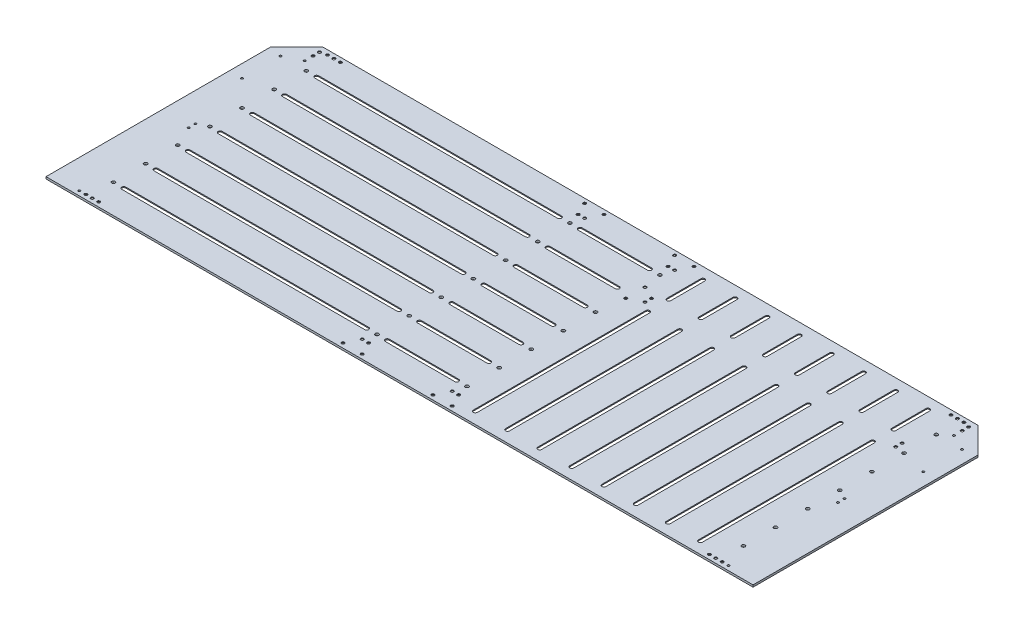
from build123d import *

# Parameters (mm, degrees)
SKETCH1_W                    = 1100
SKETCH1_H                    = 390
BOSS_EXTRUDE1_DEPTH          = 3.175
CHAMFER1_SIZE                = 40
STRUT_HOLES_D                = 3.3
FAN_HOLES_D                  = 3.3
FAN_SUPPORT_HOLES_AT_2_COUNT = 2
FAN_SUPPORT_HOLES_AT_2_PITCH = 10
FAN_SUPPORT_HOLES_AT_3_COUNT = 2
FAN_SUPPORT_HOLES_AT_3_PITCH = 10.307764064
FAN_SUPPORT_HOLES_AT_4_COUNT = 2
FAN_SUPPORT_HOLES_AT_4_PITCH = 30.103986447
FAN_SUPPORT_HOLES_AT_5_COUNT = 2
FAN_SUPPORT_HOLES_AT_5_PITCH = 20.155644371
FAN_SUPPORT_HOLES_AT_6_COUNT = 2
FAN_SUPPORT_HOLES_AT_6_PITCH = 374.035091937
FAN_SUPPORT_HOLES_AT_7_COUNT = 2
FAN_SUPPORT_HOLES_AT_7_PITCH = 374.702882295
FAN_SUPPORT_HOLES_AT_8_COUNT = 2
FAN_SUPPORT_HOLES_AT_8_PITCH = 373.633844827
T_SUPPORT_HOLES_D            = 4.5
T_SUPPORT_HOLES_DEPTH        = 15
T_SUPPORT_HOLES_CSINK_D      = 9.4
T_SUPPORT_HOLES_CSINK_ANGLE  = 90
T_SUPPORT_HOLES_TIP          = 1.351936393
ELEC_BAY_SLOTS_DEPTH         = 3.175
ELEC_BAY_SLOTS_2_DEPTH       = 1.675
BATTERY_BAY_SLOTS_DEPTH      = 3.175
BATTERY_BAY_SLOTS_2_DEPTH    = 1.675
BACK_BAY_SLOTS_DEPTH         = 3.175
BACK_BAY_SLOTS_2_DEPTH       = 1.675
LAPTOP_BAY_SLOTS_DEPTH       = 3.175
LAPTOP_BAY_SLOTS_2_DEPTH     = 1.675
MOUNTING_HOLES_D             = 5.3


# Read off the part's stored shape, not the designer's step: Elec Bay Slots, Battery Bay Slots, Back Bay Slots, Laptop Bay Slots
with BuildPart() as part:
    # Sketch1 → Boss-Extrude1 (new body)
    with BuildSketch(Plane(origin=(0, 0, 0), x_dir=(1, 0, 0), z_dir=(0, 1, 0))):
        Rectangle(SKETCH1_W, SKETCH1_H)
    extrude(amount=BOSS_EXTRUDE1_DEPTH)

    # Chamfer1
    chamfer1_edges = [part.edges().sort_by_distance(p)[0] for p in [
        (-550, 1.5875, -195),
        (550, 1.5875, -195),
    ]]
    chamfer(chamfer1_edges, length=CHAMFER1_SIZE)

    # Strut Holes (through all)
    with Locations(Plane(origin=(0, 3.175, 0), x_dir=(1, 0, 0), z_dir=(0, 1, 0))):
        with Locations((-530, 150), (-530, 90)):
            strut_holes = Hole(STRUT_HOLES_D / 2)

    # Fan Holes (through all)
    with Locations(Plane(origin=(0, 0, 0), x_dir=(-1, 0, 0), z_dir=(0, -1, 0))):
        with Locations((505, 162.5), (505, -7.5), (505, -18), (505, -188)):
            fan_holes = Hole(FAN_HOLES_D / 2)

    # Sketch15 → Fan Support Holes (revolve, cut)
    with BuildSketch(Plane(origin=(-505, 0, -185.5), x_dir=(0, 0, -1), z_dir=(1, 0, 0))):
        Polygon((0, 0), (0, 3.175), (2.25, 3.175), (2.25, 2.23), (4.48, 0), align=None)
    fan_support_holes = revolve(axis=Axis((-505, -6.35, -185.5), (0, 1, 0)), mode=Mode.SUBTRACT)

    # Fan Support Holes at 2: Fan Support Holes ×2
    with Locations(*[(0, 0, i * FAN_SUPPORT_HOLES_AT_2_PITCH) for i in range(1, FAN_SUPPORT_HOLES_AT_2_COUNT)]):
        add(fan_support_holes, mode=Mode.SUBTRACT)

    # Fan Support Holes at 3: Fan Support Holes ×2
    with Locations(*[Vector(0.9701425001453327, 0, -0.2425356250363304) * (i * FAN_SUPPORT_HOLES_AT_3_PITCH) for i in range(1, FAN_SUPPORT_HOLES_AT_3_COUNT)]):
        add(fan_support_holes, mode=Mode.SUBTRACT)

    # Fan Support Holes at 4: Fan Support Holes ×2
    with Locations(*[Vector(0.9965457582448797, 0, -0.08304547985373965) * (i * FAN_SUPPORT_HOLES_AT_4_PITCH) for i in range(1, FAN_SUPPORT_HOLES_AT_4_COUNT)]):
        add(fan_support_holes, mode=Mode.SUBTRACT)

    # Fan Support Holes at 5: Fan Support Holes ×2
    with Locations(*[Vector(0.9922778767136677, 0, -0.12403473458920776) * (i * FAN_SUPPORT_HOLES_AT_5_PITCH) for i in range(1, FAN_SUPPORT_HOLES_AT_5_COUNT)]):
        add(fan_support_holes, mode=Mode.SUBTRACT)

    # Fan Support Holes at 6: Fan Support Holes ×2
    with Locations(*[Vector(0.053470918721689506, 0, 0.9985694071275459) * (i * FAN_SUPPORT_HOLES_AT_6_PITCH) for i in range(1, FAN_SUPPORT_HOLES_AT_6_COUNT)]):
        add(fan_support_holes, mode=Mode.SUBTRACT)

    # Fan Support Holes at 7: Fan Support Holes ×2
    with Locations(*[Vector(0.08006343537117683, 0, 0.9967897703711478) * (i * FAN_SUPPORT_HOLES_AT_7_PITCH) for i in range(1, FAN_SUPPORT_HOLES_AT_7_COUNT)]):
        add(fan_support_holes, mode=Mode.SUBTRACT)

    # Fan Support Holes at 8: Fan Support Holes ×2
    with Locations(*[Vector(0.026764170694005832, 0, 0.9996417754211067) * (i * FAN_SUPPORT_HOLES_AT_8_PITCH) for i in range(1, FAN_SUPPORT_HOLES_AT_8_COUNT)]):
        add(fan_support_holes, mode=Mode.SUBTRACT)

    # Mirror1: Strut Holes, Fan Holes, Fan Support Holes across plane
    add(strut_holes.mirror(Plane(origin=(0, 0, 0), x_dir=(0, 0, 1), z_dir=(1, 0, 0))), mode=Mode.SUBTRACT)
    add(fan_holes.mirror(Plane(origin=(0, 0, 0), x_dir=(0, 0, 1), z_dir=(1, 0, 0))), mode=Mode.SUBTRACT)
    add(fan_support_holes.mirror(Plane(origin=(0, 0, 0), x_dir=(0, 0, 1), z_dir=(1, 0, 0))), mode=Mode.SUBTRACT)

    # Mirror1 copy 1 sketch → Mirror1 copy 1 (revolve, cut)
    with BuildSketch(Plane(origin=(505, 0, -175.5), x_dir=(0, 0, -1), z_dir=(-1, 0, 0))):
        Polygon((0, 0), (0, -3.175), (2.25, -3.175), (2.25, -2.23), (4.48, 0), align=None)
    revolve(axis=Axis((505, -6.35, -175.5), (0, -1, 0)), mode=Mode.SUBTRACT)

    # Mirror1 copy 2 sketch → Mirror1 copy 2 (revolve, cut)
    with BuildSketch(Plane(origin=(495, 0, -188), x_dir=(0, 0, -1), z_dir=(-1, 0, 0))):
        Polygon((0, 0), (0, -3.175), (2.25, -3.175), (2.25, -2.23), (4.48, 0), align=None)
    revolve(axis=Axis((495, -6.35, -188), (0, -1, 0)), mode=Mode.SUBTRACT)

    # Mirror1 copy 3 sketch → Mirror1 copy 3 (revolve, cut)
    with BuildSketch(Plane(origin=(475, 0, -188), x_dir=(0, 0, -1), z_dir=(-1, 0, 0))):
        Polygon((0, 0), (0, -3.175), (2.25, -3.175), (2.25, -2.23), (4.48, 0), align=None)
    revolve(axis=Axis((475, -6.35, -188), (0, -1, 0)), mode=Mode.SUBTRACT)

    # Mirror1 copy 4 sketch → Mirror1 copy 4 (revolve, cut)
    with BuildSketch(Plane(origin=(485, 0, -188), x_dir=(0, 0, -1), z_dir=(-1, 0, 0))):
        Polygon((0, 0), (0, -3.175), (2.25, -3.175), (2.25, -2.23), (4.48, 0), align=None)
    revolve(axis=Axis((485, -6.35, -188), (0, -1, 0)), mode=Mode.SUBTRACT)

    # Mirror1 copy 5 sketch → Mirror1 copy 5 (revolve, cut)
    with BuildSketch(Plane(origin=(485, 0, 188), x_dir=(0, 0, -1), z_dir=(-1, 0, 0))):
        Polygon((0, 0), (0, -3.175), (2.25, -3.175), (2.25, -2.23), (4.48, 0), align=None)
    revolve(axis=Axis((485, -6.35, 188), (0, -1, 0)), mode=Mode.SUBTRACT)

    # Mirror1 copy 6 sketch → Mirror1 copy 6 (revolve, cut)
    with BuildSketch(Plane(origin=(475, 0, 188), x_dir=(0, 0, -1), z_dir=(-1, 0, 0))):
        Polygon((0, 0), (0, -3.175), (2.25, -3.175), (2.25, -2.23), (4.48, 0), align=None)
    revolve(axis=Axis((475, -6.35, 188), (0, -1, 0)), mode=Mode.SUBTRACT)

    # Mirror1 copy 7 sketch → Mirror1 copy 7 (revolve, cut)
    with BuildSketch(Plane(origin=(495, 0, 188), x_dir=(0, 0, -1), z_dir=(-1, 0, 0))):
        Polygon((0, 0), (0, -3.175), (2.25, -3.175), (2.25, -2.23), (4.48, 0), align=None)
    revolve(axis=Axis((495, -6.35, 188), (0, -1, 0)), mode=Mode.SUBTRACT)

    # T Support Holes
    with Locations(Plane(origin=(0, 0, 0), x_dir=(-1, 0, 0), z_dir=(0, -1, 0))):
        with Locations((-75, -188), (-45, -188), (-65, -168), (-55, -168), (-55, 168), (-65, 168), (-45, 188), (-75, 188), (65, -188), (95, -188), (75, -168), (85, -168), (85, 168), (75, 168), (95, 188), (65, 188), (-65, 122), (-65, 92), (-85, 112), (-85, 102), (-475, 112), (-475, 102)):
            CounterSinkHole(T_SUPPORT_HOLES_D / 2, T_SUPPORT_HOLES_CSINK_D / 2, depth=T_SUPPORT_HOLES_DEPTH, counter_sink_angle=T_SUPPORT_HOLES_CSINK_ANGLE)
            with Locations((0, 0, -(T_SUPPORT_HOLES_DEPTH + T_SUPPORT_HOLES_TIP / 2))):  # 118° drill point
                Cone(0, T_SUPPORT_HOLES_D / 2, T_SUPPORT_HOLES_TIP, mode=Mode.SUBTRACT)

    # Elec Bay Slots outline → Elec Bay Slots (cut)
    with BuildSketch(Plane(origin=(0, 0, 0), x_dir=(1, 0, 0), z_dir=(0, 1, 0))):
        with BuildLine():
            ThreePointArc((-96, -153.1), (-92.9, -150), (-96, -146.9))
            Line((-96, -146.9), (-474, -146.9))
            ThreePointArc((-474, -146.9), (-477.1, -150), (-474, -153.1))
            Line((-474, -153.1), (-96, -153.1))
        make_face()
        with BuildLine():
            ThreePointArc((-96, -103.1), (-92.9, -100), (-96, -96.9))
            Line((-96, -96.9), (-474, -96.9))
            ThreePointArc((-474, -96.9), (-477.1, -100), (-474, -103.1))
            Line((-474, -103.1), (-96, -103.1))
        make_face()
        with BuildLine():
            ThreePointArc((-96, -53.1), (-92.9, -50), (-96, -46.9))
            Line((-96, -46.9), (-474, -46.9))
            ThreePointArc((-474, -46.9), (-477.1, -50), (-474, -53.1))
            Line((-474, -53.1), (-96, -53.1))
        make_face()
        with BuildLine():
            ThreePointArc((-96, -3.1), (-92.9, 0), (-96, 3.1))
            Line((-96, 3.1), (-474, 3.1))
            ThreePointArc((-474, 3.1), (-477.1, 0), (-474, -3.1))
            Line((-474, -3.1), (-96, -3.1))
        make_face()
        with BuildLine():
            ThreePointArc((-96, 46.9), (-92.9, 50), (-96, 53.1))
            Line((-96, 53.1), (-474, 53.1))
            ThreePointArc((-474, 53.1), (-477.1, 50), (-474, 46.9))
            Line((-474, 46.9), (-96, 46.9))
        make_face()
        with BuildLine():
            ThreePointArc((-96, 96.9), (-92.9, 100), (-96, 103.1))
            Line((-96, 103.1), (-474, 103.1))
            ThreePointArc((-474, 103.1), (-477.1, 100), (-474, 96.9))
            Line((-474, 96.9), (-96, 96.9))
        make_face()
        with BuildLine():
            ThreePointArc((-96, 146.9), (-92.9, 150), (-96, 153.1))
            Line((-96, 153.1), (-474, 153.1))
            ThreePointArc((-474, 153.1), (-477.1, 150), (-474, 146.9))
            Line((-474, 146.9), (-96, 146.9))
        make_face()
    extrude(amount=ELEC_BAY_SLOTS_DEPTH, mode=Mode.SUBTRACT)

    # Elec Bay Slots 2 outline → Elec Bay Slots 2 (cut)
    # profile 1 of 7: a face of its own
    with BuildSketch(Plane(origin=(0, 0, 0), x_dir=(1, 0, 0), z_dir=(0, 1, 0))):
        with BuildLine():
            ThreePointArc((-96, -155.5), (-90.5, -150), (-96, -144.5))
            Line((-96, -144.5), (-474, -144.5))
            ThreePointArc((-474, -144.5), (-479.5, -150), (-474, -155.5))
            Line((-474, -155.5), (-96, -155.5))
        make_face()
        with BuildLine():
            Line((-474, -146.9), (-96, -146.9))
            ThreePointArc((-96, -146.9), (-92.9, -150), (-96, -153.1))
            Line((-96, -153.1), (-474, -153.1))
            ThreePointArc((-474, -153.1), (-477.1, -150), (-474, -146.9))
        make_face(mode=Mode.SUBTRACT)
    # profile 2 of 7: a face of its own
    with BuildSketch(Plane(origin=(0, 0, 0), x_dir=(1, 0, 0), z_dir=(0, 1, 0))):
        with BuildLine():
            ThreePointArc((-96, -105.5), (-90.5, -100), (-96, -94.5))
            Line((-96, -94.5), (-474, -94.5))
            ThreePointArc((-474, -94.5), (-479.5, -100), (-474, -105.5))
            Line((-474, -105.5), (-96, -105.5))
        make_face()
        with BuildLine():
            Line((-474, -96.9), (-96, -96.9))
            ThreePointArc((-96, -96.9), (-92.9, -100), (-96, -103.1))
            Line((-96, -103.1), (-474, -103.1))
            ThreePointArc((-474, -103.1), (-477.1, -100), (-474, -96.9))
        make_face(mode=Mode.SUBTRACT)
    # profile 3 of 7: a face of its own
    with BuildSketch(Plane(origin=(0, 0, 0), x_dir=(1, 0, 0), z_dir=(0, 1, 0))):
        with BuildLine():
            ThreePointArc((-96, -55.5), (-90.5, -50), (-96, -44.5))
            Line((-96, -44.5), (-474, -44.5))
            ThreePointArc((-474, -44.5), (-479.5, -50), (-474, -55.5))
            Line((-474, -55.5), (-96, -55.5))
        make_face()
        with BuildLine():
            Line((-474, -46.9), (-96, -46.9))
            ThreePointArc((-96, -46.9), (-92.9, -50), (-96, -53.1))
            Line((-96, -53.1), (-474, -53.1))
            ThreePointArc((-474, -53.1), (-477.1, -50), (-474, -46.9))
        make_face(mode=Mode.SUBTRACT)
    # profile 4 of 7: a face of its own
    with BuildSketch(Plane(origin=(0, 0, 0), x_dir=(1, 0, 0), z_dir=(0, 1, 0))):
        with BuildLine():
            ThreePointArc((-96, -5.5), (-90.5, 0), (-96, 5.5))
            Line((-96, 5.5), (-474, 5.5))
            ThreePointArc((-474, 5.5), (-479.5, 0), (-474, -5.5))
            Line((-474, -5.5), (-96, -5.5))
        make_face()
        with BuildLine():
            Line((-474, 3.1), (-96, 3.1))
            ThreePointArc((-96, 3.1), (-92.9, 0), (-96, -3.1))
            Line((-96, -3.1), (-474, -3.1))
            ThreePointArc((-474, -3.1), (-477.1, 0), (-474, 3.1))
        make_face(mode=Mode.SUBTRACT)
    # profile 5 of 7: a face of its own
    with BuildSketch(Plane(origin=(0, 0, 0), x_dir=(1, 0, 0), z_dir=(0, 1, 0))):
        with BuildLine():
            ThreePointArc((-96, 44.5), (-90.5, 50), (-96, 55.5))
            Line((-96, 55.5), (-474, 55.5))
            ThreePointArc((-474, 55.5), (-479.5, 50), (-474, 44.5))
            Line((-474, 44.5), (-96, 44.5))
        make_face()
        with BuildLine():
            Line((-474, 53.1), (-96, 53.1))
            ThreePointArc((-96, 53.1), (-92.9, 50), (-96, 46.9))
            Line((-96, 46.9), (-474, 46.9))
            ThreePointArc((-474, 46.9), (-477.1, 50), (-474, 53.1))
        make_face(mode=Mode.SUBTRACT)
    # profile 6 of 7: a face of its own
    with BuildSketch(Plane(origin=(0, 0, 0), x_dir=(1, 0, 0), z_dir=(0, 1, 0))):
        with BuildLine():
            ThreePointArc((-96, 94.5), (-90.5, 100), (-96, 105.5))
            Line((-96, 105.5), (-474, 105.5))
            ThreePointArc((-474, 105.5), (-479.5, 100), (-474, 94.5))
            Line((-474, 94.5), (-96, 94.5))
        make_face()
        with BuildLine():
            Line((-474, 103.1), (-96, 103.1))
            ThreePointArc((-96, 103.1), (-92.9, 100), (-96, 96.9))
            Line((-96, 96.9), (-474, 96.9))
            ThreePointArc((-474, 96.9), (-477.1, 100), (-474, 103.1))
        make_face(mode=Mode.SUBTRACT)
    # profile 7 of 7: a face of its own
    with BuildSketch(Plane(origin=(0, 0, 0), x_dir=(1, 0, 0), z_dir=(0, 1, 0))):
        with BuildLine():
            ThreePointArc((-96, 144.5), (-90.5, 150), (-96, 155.5))
            Line((-96, 155.5), (-474, 155.5))
            ThreePointArc((-474, 155.5), (-479.5, 150), (-474, 144.5))
            Line((-474, 144.5), (-96, 144.5))
        make_face()
        with BuildLine():
            Line((-474, 153.1), (-96, 153.1))
            ThreePointArc((-96, 153.1), (-92.9, 150), (-96, 146.9))
            Line((-96, 146.9), (-474, 146.9))
            ThreePointArc((-474, 146.9), (-477.1, 150), (-474, 153.1))
        make_face(mode=Mode.SUBTRACT)
    extrude(amount=ELEC_BAY_SLOTS_2_DEPTH, mode=Mode.SUBTRACT)

    # Battery Bay Slots outline → Battery Bay Slots (cut)
    with BuildSketch(Plane(origin=(0, 0, 0), x_dir=(1, 0, 0), z_dir=(0, 1, 0))):
        with BuildLine():
            ThreePointArc((-64, -146.9), (-67.1, -150), (-64, -153.1))
            Line((-64, -153.1), (44, -153.1))
            ThreePointArc((44, -153.1), (47.1, -150), (44, -146.9))
            Line((44, -146.9), (-64, -146.9))
        make_face()
        with BuildLine():
            ThreePointArc((-64, -96.9), (-67.1, -100), (-64, -103.1))
            Line((-64, -103.1), (44, -103.1))
            ThreePointArc((44, -103.1), (47.1, -100), (44, -96.9))
            Line((44, -96.9), (-64, -96.9))
        make_face()
        with BuildLine():
            ThreePointArc((-64, -46.9), (-67.1, -50), (-64, -53.1))
            Line((-64, -53.1), (44, -53.1))
            ThreePointArc((44, -53.1), (47.1, -50), (44, -46.9))
            Line((44, -46.9), (-64, -46.9))
        make_face()
        with BuildLine():
            ThreePointArc((-64, 3.1), (-67.1, 0), (-64, -3.1))
            Line((-64, -3.1), (44, -3.1))
            ThreePointArc((44, -3.1), (47.1, 0), (44, 3.1))
            Line((44, 3.1), (-64, 3.1))
        make_face()
        with BuildLine():
            ThreePointArc((-64, 53.1), (-67.1, 50), (-64, 46.9))
            Line((-64, 46.9), (44, 46.9))
            ThreePointArc((44, 46.9), (47.1, 50), (44, 53.1))
            Line((44, 53.1), (-64, 53.1))
        make_face()
        with BuildLine():
            ThreePointArc((-64, 103.1), (-67.1, 100), (-64, 96.9))
            Line((-64, 96.9), (44, 96.9))
            ThreePointArc((44, 96.9), (47.1, 100), (44, 103.1))
            Line((44, 103.1), (-64, 103.1))
        make_face()
        with BuildLine():
            ThreePointArc((-64, 153.1), (-67.1, 150), (-64, 146.9))
            Line((-64, 146.9), (44, 146.9))
            ThreePointArc((44, 146.9), (47.1, 150), (44, 153.1))
            Line((44, 153.1), (-64, 153.1))
        make_face()
    extrude(amount=BATTERY_BAY_SLOTS_DEPTH, mode=Mode.SUBTRACT)

    # Battery Bay Slots 2 outline → Battery Bay Slots 2 (cut)
    # profile 1 of 7: a face of its own
    with BuildSketch(Plane(origin=(0, 0, 0), x_dir=(1, 0, 0), z_dir=(0, 1, 0))):
        with BuildLine():
            ThreePointArc((-64, -144.5), (-69.5, -150), (-64, -155.5))
            Line((-64, -155.5), (44, -155.5))
            ThreePointArc((44, -155.5), (49.5, -150), (44, -144.5))
            Line((44, -144.5), (-64, -144.5))
        make_face()
        with BuildLine():
            Line((44, -153.1), (-64, -153.1))
            ThreePointArc((-64, -153.1), (-67.1, -150), (-64, -146.9))
            Line((-64, -146.9), (44, -146.9))
            ThreePointArc((44, -146.9), (47.1, -150), (44, -153.1))
        make_face(mode=Mode.SUBTRACT)
    # profile 2 of 7: a face of its own
    with BuildSketch(Plane(origin=(0, 0, 0), x_dir=(1, 0, 0), z_dir=(0, 1, 0))):
        with BuildLine():
            ThreePointArc((-64, -94.5), (-69.5, -100), (-64, -105.5))
            Line((-64, -105.5), (44, -105.5))
            ThreePointArc((44, -105.5), (49.5, -100), (44, -94.5))
            Line((44, -94.5), (-64, -94.5))
        make_face()
        with BuildLine():
            Line((44, -103.1), (-64, -103.1))
            ThreePointArc((-64, -103.1), (-67.1, -100), (-64, -96.9))
            Line((-64, -96.9), (44, -96.9))
            ThreePointArc((44, -96.9), (47.1, -100), (44, -103.1))
        make_face(mode=Mode.SUBTRACT)
    # profile 3 of 7: a face of its own
    with BuildSketch(Plane(origin=(0, 0, 0), x_dir=(1, 0, 0), z_dir=(0, 1, 0))):
        with BuildLine():
            ThreePointArc((-64, -44.5), (-69.5, -50), (-64, -55.5))
            Line((-64, -55.5), (44, -55.5))
            ThreePointArc((44, -55.5), (49.5, -50), (44, -44.5))
            Line((44, -44.5), (-64, -44.5))
        make_face()
        with BuildLine():
            Line((44, -53.1), (-64, -53.1))
            ThreePointArc((-64, -53.1), (-67.1, -50), (-64, -46.9))
            Line((-64, -46.9), (44, -46.9))
            ThreePointArc((44, -46.9), (47.1, -50), (44, -53.1))
        make_face(mode=Mode.SUBTRACT)
    # profile 4 of 7: a face of its own
    with BuildSketch(Plane(origin=(0, 0, 0), x_dir=(1, 0, 0), z_dir=(0, 1, 0))):
        with BuildLine():
            ThreePointArc((-64, 5.5), (-69.5, 0), (-64, -5.5))
            Line((-64, -5.5), (44, -5.5))
            ThreePointArc((44, -5.5), (49.5, 0), (44, 5.5))
            Line((44, 5.5), (-64, 5.5))
        make_face()
        with BuildLine():
            Line((44, -3.1), (-64, -3.1))
            ThreePointArc((-64, -3.1), (-67.1, 0), (-64, 3.1))
            Line((-64, 3.1), (44, 3.1))
            ThreePointArc((44, 3.1), (47.1, 0), (44, -3.1))
        make_face(mode=Mode.SUBTRACT)
    # profile 5 of 7: a face of its own
    with BuildSketch(Plane(origin=(0, 0, 0), x_dir=(1, 0, 0), z_dir=(0, 1, 0))):
        with BuildLine():
            ThreePointArc((-64, 55.5), (-69.5, 50), (-64, 44.5))
            Line((-64, 44.5), (44, 44.5))
            ThreePointArc((44, 44.5), (49.5, 50), (44, 55.5))
            Line((44, 55.5), (-64, 55.5))
        make_face()
        with BuildLine():
            Line((44, 46.9), (-64, 46.9))
            ThreePointArc((-64, 46.9), (-67.1, 50), (-64, 53.1))
            Line((-64, 53.1), (44, 53.1))
            ThreePointArc((44, 53.1), (47.1, 50), (44, 46.9))
        make_face(mode=Mode.SUBTRACT)
    # profile 6 of 7: a face of its own
    with BuildSketch(Plane(origin=(0, 0, 0), x_dir=(1, 0, 0), z_dir=(0, 1, 0))):
        with BuildLine():
            ThreePointArc((-64, 105.5), (-69.5, 100), (-64, 94.5))
            Line((-64, 94.5), (44, 94.5))
            ThreePointArc((44, 94.5), (49.5, 100), (44, 105.5))
            Line((44, 105.5), (-64, 105.5))
        make_face()
        with BuildLine():
            Line((44, 96.9), (-64, 96.9))
            ThreePointArc((-64, 96.9), (-67.1, 100), (-64, 103.1))
            Line((-64, 103.1), (44, 103.1))
            ThreePointArc((44, 103.1), (47.1, 100), (44, 96.9))
        make_face(mode=Mode.SUBTRACT)
    # profile 7 of 7: a face of its own
    with BuildSketch(Plane(origin=(0, 0, 0), x_dir=(1, 0, 0), z_dir=(0, 1, 0))):
        with BuildLine():
            ThreePointArc((-64, 155.5), (-69.5, 150), (-64, 144.5))
            Line((-64, 144.5), (44, 144.5))
            ThreePointArc((44, 144.5), (49.5, 150), (44, 155.5))
            Line((44, 155.5), (-64, 155.5))
        make_face()
        with BuildLine():
            Line((44, 146.9), (-64, 146.9))
            ThreePointArc((-64, 146.9), (-67.1, 150), (-64, 153.1))
            Line((-64, 153.1), (44, 153.1))
            ThreePointArc((44, 153.1), (47.1, 150), (44, 146.9))
        make_face(mode=Mode.SUBTRACT)
    extrude(amount=BATTERY_BAY_SLOTS_2_DEPTH, mode=Mode.SUBTRACT)

    # Back Bay Slots outline → Back Bay Slots (cut)
    with BuildSketch(Plane(origin=(0, 0, 0), x_dir=(1, 0, 0), z_dir=(0, 1, 0))):
        with BuildLine():
            ThreePointArc((103.1, 177), (100, 180.1), (96.9, 177))
            Line((96.9, 177), (96.9, 124))
            ThreePointArc((96.9, 124), (100, 120.9), (103.1, 124))
            Line((103.1, 124), (103.1, 177))
        make_face()
        with BuildLine():
            ThreePointArc((153.1, 177), (150, 180.1), (146.9, 177))
            Line((146.9, 177), (146.9, 124))
            ThreePointArc((146.9, 124), (150, 120.9), (153.1, 124))
            Line((153.1, 124), (153.1, 177))
        make_face()
        with BuildLine():
            ThreePointArc((203.1, 177), (200, 180.1), (196.9, 177))
            Line((196.9, 177), (196.9, 124))
            ThreePointArc((196.9, 124), (200, 120.9), (203.1, 124))
            Line((203.1, 124), (203.1, 177))
        make_face()
        with BuildLine():
            ThreePointArc((253.1, 177), (250, 180.1), (246.9, 177))
            Line((246.9, 177), (246.9, 124))
            ThreePointArc((246.9, 124), (250, 120.9), (253.1, 124))
            Line((253.1, 124), (253.1, 177))
        make_face()
        with BuildLine():
            ThreePointArc((303.1, 177), (300, 180.1), (296.9, 177))
            Line((296.9, 177), (296.9, 124))
            ThreePointArc((296.9, 124), (300, 120.9), (303.1, 124))
            Line((303.1, 124), (303.1, 177))
        make_face()
        with BuildLine():
            ThreePointArc((353.1, 177), (350, 180.1), (346.9, 177))
            Line((346.9, 177), (346.9, 124))
            ThreePointArc((346.9, 124), (350, 120.9), (353.1, 124))
            Line((353.1, 124), (353.1, 177))
        make_face()
        with BuildLine():
            ThreePointArc((403.1, 177), (400, 180.1), (396.9, 177))
            Line((396.9, 177), (396.9, 124))
            ThreePointArc((396.9, 124), (400, 120.9), (403.1, 124))
            Line((403.1, 124), (403.1, 177))
        make_face()
        with BuildLine():
            ThreePointArc((453.1, 177), (450, 180.1), (446.9, 177))
            Line((446.9, 177), (446.9, 124))
            ThreePointArc((446.9, 124), (450, 120.9), (453.1, 124))
            Line((453.1, 124), (453.1, 177))
        make_face()
    extrude(amount=BACK_BAY_SLOTS_DEPTH, mode=Mode.SUBTRACT)

    # Back Bay Slots 2 outline → Back Bay Slots 2 (cut)
    # profile 1 of 8: a face of its own
    with BuildSketch(Plane(origin=(0, 0, 0), x_dir=(1, 0, 0), z_dir=(0, 1, 0))):
        with BuildLine():
            ThreePointArc((105.5, 177), (100, 182.5), (94.5, 177))
            Line((94.5, 177), (94.5, 124))
            ThreePointArc((94.5, 124), (100, 118.5), (105.5, 124))
            Line((105.5, 124), (105.5, 177))
        make_face()
        with BuildLine():
            Line((96.9, 124), (96.9, 177))
            ThreePointArc((96.9, 177), (100, 180.1), (103.1, 177))
            Line((103.1, 177), (103.1, 124))
            ThreePointArc((103.1, 124), (100, 120.9), (96.9, 124))
        make_face(mode=Mode.SUBTRACT)
    # profile 2 of 8: a face of its own
    with BuildSketch(Plane(origin=(0, 0, 0), x_dir=(1, 0, 0), z_dir=(0, 1, 0))):
        with BuildLine():
            ThreePointArc((155.5, 177), (150, 182.5), (144.5, 177))
            Line((144.5, 177), (144.5, 124))
            ThreePointArc((144.5, 124), (150, 118.5), (155.5, 124))
            Line((155.5, 124), (155.5, 177))
        make_face()
        with BuildLine():
            Line((146.9, 124), (146.9, 177))
            ThreePointArc((146.9, 177), (150, 180.1), (153.1, 177))
            Line((153.1, 177), (153.1, 124))
            ThreePointArc((153.1, 124), (150, 120.9), (146.9, 124))
        make_face(mode=Mode.SUBTRACT)
    # profile 3 of 8: a face of its own
    with BuildSketch(Plane(origin=(0, 0, 0), x_dir=(1, 0, 0), z_dir=(0, 1, 0))):
        with BuildLine():
            ThreePointArc((205.5, 177), (200, 182.5), (194.5, 177))
            Line((194.5, 177), (194.5, 124))
            ThreePointArc((194.5, 124), (200, 118.5), (205.5, 124))
            Line((205.5, 124), (205.5, 177))
        make_face()
        with BuildLine():
            Line((196.9, 124), (196.9, 177))
            ThreePointArc((196.9, 177), (200, 180.1), (203.1, 177))
            Line((203.1, 177), (203.1, 124))
            ThreePointArc((203.1, 124), (200, 120.9), (196.9, 124))
        make_face(mode=Mode.SUBTRACT)
    # profile 4 of 8: a face of its own
    with BuildSketch(Plane(origin=(0, 0, 0), x_dir=(1, 0, 0), z_dir=(0, 1, 0))):
        with BuildLine():
            ThreePointArc((255.5, 177), (250, 182.5), (244.5, 177))
            Line((244.5, 177), (244.5, 124))
            ThreePointArc((244.5, 124), (250, 118.5), (255.5, 124))
            Line((255.5, 124), (255.5, 177))
        make_face()
        with BuildLine():
            Line((246.9, 124), (246.9, 177))
            ThreePointArc((246.9, 177), (250, 180.1), (253.1, 177))
            Line((253.1, 177), (253.1, 124))
            ThreePointArc((253.1, 124), (250, 120.9), (246.9, 124))
        make_face(mode=Mode.SUBTRACT)
    # profile 5 of 8: a face of its own
    with BuildSketch(Plane(origin=(0, 0, 0), x_dir=(1, 0, 0), z_dir=(0, 1, 0))):
        with BuildLine():
            ThreePointArc((305.5, 177), (300, 182.5), (294.5, 177))
            Line((294.5, 177), (294.5, 124))
            ThreePointArc((294.5, 124), (300, 118.5), (305.5, 124))
            Line((305.5, 124), (305.5, 177))
        make_face()
        with BuildLine():
            Line((296.9, 124), (296.9, 177))
            ThreePointArc((296.9, 177), (300, 180.1), (303.1, 177))
            Line((303.1, 177), (303.1, 124))
            ThreePointArc((303.1, 124), (300, 120.9), (296.9, 124))
        make_face(mode=Mode.SUBTRACT)
    # profile 6 of 8: a face of its own
    with BuildSketch(Plane(origin=(0, 0, 0), x_dir=(1, 0, 0), z_dir=(0, 1, 0))):
        with BuildLine():
            ThreePointArc((355.5, 177), (350, 182.5), (344.5, 177))
            Line((344.5, 177), (344.5, 124))
            ThreePointArc((344.5, 124), (350, 118.5), (355.5, 124))
            Line((355.5, 124), (355.5, 177))
        make_face()
        with BuildLine():
            Line((346.9, 124), (346.9, 177))
            ThreePointArc((346.9, 177), (350, 180.1), (353.1, 177))
            Line((353.1, 177), (353.1, 124))
            ThreePointArc((353.1, 124), (350, 120.9), (346.9, 124))
        make_face(mode=Mode.SUBTRACT)
    # profile 7 of 8: a face of its own
    with BuildSketch(Plane(origin=(0, 0, 0), x_dir=(1, 0, 0), z_dir=(0, 1, 0))):
        with BuildLine():
            ThreePointArc((405.5, 177), (400, 182.5), (394.5, 177))
            Line((394.5, 177), (394.5, 124))
            ThreePointArc((394.5, 124), (400, 118.5), (405.5, 124))
            Line((405.5, 124), (405.5, 177))
        make_face()
        with BuildLine():
            Line((396.9, 124), (396.9, 177))
            ThreePointArc((396.9, 177), (400, 180.1), (403.1, 177))
            Line((403.1, 177), (403.1, 124))
            ThreePointArc((403.1, 124), (400, 120.9), (396.9, 124))
        make_face(mode=Mode.SUBTRACT)
    # profile 8 of 8: a face of its own
    with BuildSketch(Plane(origin=(0, 0, 0), x_dir=(1, 0, 0), z_dir=(0, 1, 0))):
        with BuildLine():
            ThreePointArc((455.5, 177), (450, 182.5), (444.5, 177))
            Line((444.5, 177), (444.5, 124))
            ThreePointArc((444.5, 124), (450, 118.5), (455.5, 124))
            Line((455.5, 124), (455.5, 177))
        make_face()
        with BuildLine():
            Line((446.9, 124), (446.9, 177))
            ThreePointArc((446.9, 177), (450, 180.1), (453.1, 177))
            Line((453.1, 177), (453.1, 124))
            ThreePointArc((453.1, 124), (450, 120.9), (446.9, 124))
        make_face(mode=Mode.SUBTRACT)
    extrude(amount=BACK_BAY_SLOTS_2_DEPTH, mode=Mode.SUBTRACT)

    # Laptop Bay Slots outline → Laptop Bay Slots (cut)
    with BuildSketch(Plane(origin=(0, 0, 0), x_dir=(1, 0, 0), z_dir=(0, 1, 0))):
        with BuildLine():
            Line((103.1, -177), (103.1, 91))
            ThreePointArc((103.1, 91), (100, 94.1), (96.9, 91))
            Line((96.9, 91), (96.9, -177))
            ThreePointArc((96.9, -177), (100, -180.1), (103.1, -177))
        make_face()
        with BuildLine():
            Line((153.1, -177), (153.1, 91))
            ThreePointArc((153.1, 91), (150, 94.1), (146.9, 91))
            Line((146.9, 91), (146.9, -177))
            ThreePointArc((146.9, -177), (150, -180.1), (153.1, -177))
        make_face()
        with BuildLine():
            Line((203.1, -177), (203.1, 91))
            ThreePointArc((203.1, 91), (200, 94.1), (196.9, 91))
            Line((196.9, 91), (196.9, -177))
            ThreePointArc((196.9, -177), (200, -180.1), (203.1, -177))
        make_face()
        with BuildLine():
            Line((253.1, -177), (253.1, 91))
            ThreePointArc((253.1, 91), (250, 94.1), (246.9, 91))
            Line((246.9, 91), (246.9, -177))
            ThreePointArc((246.9, -177), (250, -180.1), (253.1, -177))
        make_face()
        with BuildLine():
            Line((303.1, -177), (303.1, 91))
            ThreePointArc((303.1, 91), (300, 94.1), (296.9, 91))
            Line((296.9, 91), (296.9, -177))
            ThreePointArc((296.9, -177), (300, -180.1), (303.1, -177))
        make_face()
        with BuildLine():
            Line((353.1, -177), (353.1, 91))
            ThreePointArc((353.1, 91), (350, 94.1), (346.9, 91))
            Line((346.9, 91), (346.9, -177))
            ThreePointArc((346.9, -177), (350, -180.1), (353.1, -177))
        make_face()
        with BuildLine():
            Line((403.1, -177), (403.1, 91))
            ThreePointArc((403.1, 91), (400, 94.1), (396.9, 91))
            Line((396.9, 91), (396.9, -177))
            ThreePointArc((396.9, -177), (400, -180.1), (403.1, -177))
        make_face()
        with BuildLine():
            Line((453.1, -177), (453.1, 91))
            ThreePointArc((453.1, 91), (450, 94.1), (446.9, 91))
            Line((446.9, 91), (446.9, -177))
            ThreePointArc((446.9, -177), (450, -180.1), (453.1, -177))
        make_face()
    extrude(amount=LAPTOP_BAY_SLOTS_DEPTH, mode=Mode.SUBTRACT)

    # Laptop Bay Slots 2 outline → Laptop Bay Slots 2 (cut)
    # profile 1 of 8: a face of its own
    with BuildSketch(Plane(origin=(0, 0, 0), x_dir=(1, 0, 0), z_dir=(0, 1, 0))):
        with BuildLine():
            Line((105.5, -177), (105.5, 91))
            ThreePointArc((105.5, 91), (100, 96.5), (94.5, 91))
            Line((94.5, 91), (94.5, -177))
            ThreePointArc((94.5, -177), (100, -182.5), (105.5, -177))
        make_face()
        with BuildLine():
            ThreePointArc((96.9, 91), (100, 94.1), (103.1, 91))
            Line((103.1, 91), (103.1, -177))
            ThreePointArc((103.1, -177), (100, -180.1), (96.9, -177))
            Line((96.9, -177), (96.9, 91))
        make_face(mode=Mode.SUBTRACT)
    # profile 2 of 8: a face of its own
    with BuildSketch(Plane(origin=(0, 0, 0), x_dir=(1, 0, 0), z_dir=(0, 1, 0))):
        with BuildLine():
            Line((155.5, -177), (155.5, 91))
            ThreePointArc((155.5, 91), (150, 96.5), (144.5, 91))
            Line((144.5, 91), (144.5, -177))
            ThreePointArc((144.5, -177), (150, -182.5), (155.5, -177))
        make_face()
        with BuildLine():
            ThreePointArc((146.9, 91), (150, 94.1), (153.1, 91))
            Line((153.1, 91), (153.1, -177))
            ThreePointArc((153.1, -177), (150, -180.1), (146.9, -177))
            Line((146.9, -177), (146.9, 91))
        make_face(mode=Mode.SUBTRACT)
    # profile 3 of 8: a face of its own
    with BuildSketch(Plane(origin=(0, 0, 0), x_dir=(1, 0, 0), z_dir=(0, 1, 0))):
        with BuildLine():
            Line((205.5, -177), (205.5, 91))
            ThreePointArc((205.5, 91), (200, 96.5), (194.5, 91))
            Line((194.5, 91), (194.5, -177))
            ThreePointArc((194.5, -177), (200, -182.5), (205.5, -177))
        make_face()
        with BuildLine():
            ThreePointArc((196.9, 91), (200, 94.1), (203.1, 91))
            Line((203.1, 91), (203.1, -177))
            ThreePointArc((203.1, -177), (200, -180.1), (196.9, -177))
            Line((196.9, -177), (196.9, 91))
        make_face(mode=Mode.SUBTRACT)
    # profile 4 of 8: a face of its own
    with BuildSketch(Plane(origin=(0, 0, 0), x_dir=(1, 0, 0), z_dir=(0, 1, 0))):
        with BuildLine():
            Line((255.5, -177), (255.5, 91))
            ThreePointArc((255.5, 91), (250, 96.5), (244.5, 91))
            Line((244.5, 91), (244.5, -177))
            ThreePointArc((244.5, -177), (250, -182.5), (255.5, -177))
        make_face()
        with BuildLine():
            ThreePointArc((246.9, 91), (250, 94.1), (253.1, 91))
            Line((253.1, 91), (253.1, -177))
            ThreePointArc((253.1, -177), (250, -180.1), (246.9, -177))
            Line((246.9, -177), (246.9, 91))
        make_face(mode=Mode.SUBTRACT)
    # profile 5 of 8: a face of its own
    with BuildSketch(Plane(origin=(0, 0, 0), x_dir=(1, 0, 0), z_dir=(0, 1, 0))):
        with BuildLine():
            Line((305.5, -177), (305.5, 91))
            ThreePointArc((305.5, 91), (300, 96.5), (294.5, 91))
            Line((294.5, 91), (294.5, -177))
            ThreePointArc((294.5, -177), (300, -182.5), (305.5, -177))
        make_face()
        with BuildLine():
            ThreePointArc((296.9, 91), (300, 94.1), (303.1, 91))
            Line((303.1, 91), (303.1, -177))
            ThreePointArc((303.1, -177), (300, -180.1), (296.9, -177))
            Line((296.9, -177), (296.9, 91))
        make_face(mode=Mode.SUBTRACT)
    # profile 6 of 8: a face of its own
    with BuildSketch(Plane(origin=(0, 0, 0), x_dir=(1, 0, 0), z_dir=(0, 1, 0))):
        with BuildLine():
            Line((355.5, -177), (355.5, 91))
            ThreePointArc((355.5, 91), (350, 96.5), (344.5, 91))
            Line((344.5, 91), (344.5, -177))
            ThreePointArc((344.5, -177), (350, -182.5), (355.5, -177))
        make_face()
        with BuildLine():
            ThreePointArc((346.9, 91), (350, 94.1), (353.1, 91))
            Line((353.1, 91), (353.1, -177))
            ThreePointArc((353.1, -177), (350, -180.1), (346.9, -177))
            Line((346.9, -177), (346.9, 91))
        make_face(mode=Mode.SUBTRACT)
    # profile 7 of 8: a face of its own
    with BuildSketch(Plane(origin=(0, 0, 0), x_dir=(1, 0, 0), z_dir=(0, 1, 0))):
        with BuildLine():
            Line((405.5, -177), (405.5, 91))
            ThreePointArc((405.5, 91), (400, 96.5), (394.5, 91))
            Line((394.5, 91), (394.5, -177))
            ThreePointArc((394.5, -177), (400, -182.5), (405.5, -177))
        make_face()
        with BuildLine():
            ThreePointArc((396.9, 91), (400, 94.1), (403.1, 91))
            Line((403.1, 91), (403.1, -177))
            ThreePointArc((403.1, -177), (400, -180.1), (396.9, -177))
            Line((396.9, -177), (396.9, 91))
        make_face(mode=Mode.SUBTRACT)
    # profile 8 of 8: a face of its own
    with BuildSketch(Plane(origin=(0, 0, 0), x_dir=(1, 0, 0), z_dir=(0, 1, 0))):
        with BuildLine():
            Line((455.5, -177), (455.5, 91))
            ThreePointArc((455.5, 91), (450, 96.5), (444.5, 91))
            Line((444.5, 91), (444.5, -177))
            ThreePointArc((444.5, -177), (450, -182.5), (455.5, -177))
        make_face()
        with BuildLine():
            ThreePointArc((446.9, 91), (450, 94.1), (453.1, 91))
            Line((453.1, 91), (453.1, -177))
            ThreePointArc((453.1, -177), (450, -180.1), (446.9, -177))
            Line((446.9, -177), (446.9, 91))
        make_face(mode=Mode.SUBTRACT)
    extrude(amount=LAPTOP_BAY_SLOTS_2_DEPTH, mode=Mode.SUBTRACT)

    # Mounting Holes (through all)
    with Locations(Plane(origin=(0, 0, 0), x_dir=(-1, 0, 0), z_dir=(0, -1, 0))):
        with Locations((-60, 150), (-60, -150), (-490, 150), (-60, 50), (-60, 0), (-60, -50), (-60, -100), (80, 150), (80, 100), (80, 50), (80, 0), (80, -50), (80, -100), (80, -150), (-490, 100), (-490, 50), (-490, 0), (-490, -50), (-490, -100), (-490, -150), (490, -150), (490, -100), (490, -50), (490, 0), (490, 50), (490, 100), (490, 150)):
            Hole(MOUNTING_HOLES_D / 2)


solid = part.part
